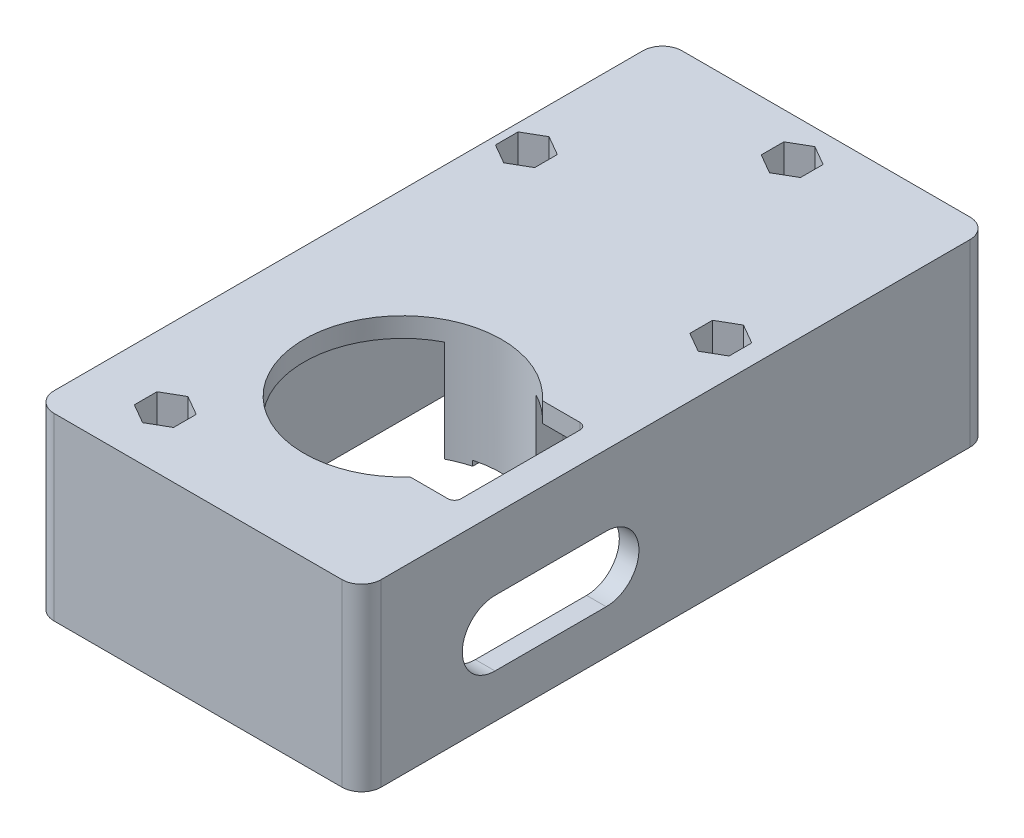
from build123d import *
from build123d.topology import SkipClean

# Parameters (mm, degrees)
SKETCH_1_W               = 50
SKETCH_1_H               = 38
EXTRUDE_1_DEPTH          = 3
SKETCH_2_W               = 50
SKETCH_2_H               = 38
SKETCH_2_W_2             = 44
SKETCH_2_H_2             = 32
EXTRUDE_2_DEPTH          = 90
SKETCH_4_R               = 7.3
CUT_EXTRUDE_1_DEPTH      = 45.2
SKETCH_5_R               = 10.3
SKETCH_5_R_2             = 7.3
EXTRUDE_3_DEPTH          = 16
SKETCH_6_R               = 8.3
SKETCH_6_R_2             = 5.8
EXTRUDE_5_DEPTH          = 1
SKETCH_7_R               = 4.3
EXTRUDE_6_DEPTH          = 2
SKETCH_8_R               = 6.3
SKETCH_8_R_2             = 4.3
EXTRUDE_7_DEPTH          = 10
SKETCH_9_W               = 2.635644668
SKETCH_9_H               = 4.5
CUT_EXTRUDE_2_DEPTH      = 4
SKETCH_10_R              = 0.7
SKETCH_10_W              = 2.7
SKETCH_10_H              = 2
EXTRUDE_8_DEPTH          = 32
SKETCH_11_W              = 14.06
SKETCH_11_H              = 9.36
EXTRUDE_9_DEPTH          = 4.4
SKETCH_12_W              = 14.06
SKETCH_12_H              = 9.36
EXTRUDE_10_DEPTH         = 21.2
CUT_EXTRUDE_3_DEPTH      = 3
SKETCH_14_R              = 1.65
EXTRUDE_11_DEPTH         = 15.5
EXTRUDE_12_DEPTH         = 15.5
CUT_EXTRUDE_4_DEPTH      = 0.8
EXTRUDE_13_DEPTH         = 18
SKETCH_18_W              = 19.83
SKETCH_18_H              = 32
SKETCH_18_R              = 6.3
EXTRUDE_14_DEPTH         = 10
SKETCH_19_W              = 4.445486426
SKETCH_19_H              = 4.5
CUT_EXTRUDE_5_DEPTH      = 4
EXTRUDE_16_REACH         = 110.743
SKETCH_23_R              = 1.65
CUT_EXTRUDE_7_DEPTH      = 109.742815855
CUT_EXTRUDE_7_DEPTH_BACK = 109.742815855
SKETCH_25_R              = 1.65
CUT_EXTRUDE_8_DEPTH      = 24.5
SKETCH_29_W              = 50
SKETCH_29_H              = 38
EXTRUDE_17_DEPTH         = 3
SKETCH_30_W              = 96
SKETCH_30_H              = 0.02
CUT_EXTRUDE_9_DEPTH      = 113.218536793
FILLET_1_R               = 3
CUT_EXTRUDE_10_DEPTH     = 3


with BuildPart() as part:
    # 草图1 → 凸台-拉伸1 (new body)
    with BuildSketch(Plane.XY):
        with Locations((25, 19)):
            Rectangle(SKETCH_1_W, SKETCH_1_H)
    extrude(amount=-EXTRUDE_1_DEPTH)

    # 草图2 → 凸台-拉伸2 (add)
    with BuildSketch(Plane.XY):
        with Locations((25, 19)):
            Rectangle(SKETCH_2_W, SKETCH_2_H)
        with Locations((25, 19)):
            Rectangle(SKETCH_2_W_2, SKETCH_2_H_2, mode=Mode.SUBTRACT)
    extrude(amount=EXTRUDE_2_DEPTH)

    # 草图4 → 切除-拉伸1 (cut)
    with BuildSketch(Plane(origin=(0, 0, -3), x_dir=(-1, 0, 0), z_dir=(0, 0, -1))):
        with Locations((-12.5, 10.5)):
            Circle(SKETCH_4_R)
    extrude(amount=-CUT_EXTRUDE_1_DEPTH, mode=Mode.SUBTRACT)

    # 草图5 → 凸台-拉伸3 (add)
    with BuildSketch(Plane.XY):
        with Locations((12.5, 10.5)):
            Circle(SKETCH_5_R)
        with Locations(Location((12.5, 10.5, 0), (0, 0, 180))):
            Circle(SKETCH_5_R_2, mode=Mode.SUBTRACT)
    extrude(amount=EXTRUDE_3_DEPTH)

    # 草图6 → 凸台-拉伸5 (add)
    with BuildSketch(Plane(origin=(0, 0, -3), x_dir=(-1, 0, 0), z_dir=(0, 0, -1))):
        with Locations((-12.5, 10.5)):
            Circle(SKETCH_6_R)
        with Locations((-12.5, 10.5)):
            Circle(SKETCH_6_R_2, mode=Mode.SUBTRACT)
    extrude(amount=-EXTRUDE_5_DEPTH)

    # 草图7 → 凸台-拉伸6 (add)
    with BuildSketch(Plane.XY.offset(16)):
        with BuildLine():
            Line((5.440254962, 3), (19.559745038, 3))
            ThreePointArc((19.559745038, 3), (18.368221419, 18.964867239), (3, 14.479949748))
            Line((3, 14.479949748), (3, 6.520050252))
            ThreePointArc((3, 6.520050252), (4.035132761, 4.631778581), (5.440254962, 3))
        make_face()
        with Locations((12.5, 10.5)):
            Circle(SKETCH_7_R, mode=Mode.SUBTRACT)
    extrude(amount=EXTRUDE_6_DEPTH)

    # 草图8 → 凸台-拉伸7 (add)
    with BuildSketch(Plane.XY.offset(18)):
        with Locations((12.5, 10.5)):
            Circle(SKETCH_8_R)
        with Locations((12.5, 10.5)):
            Circle(SKETCH_8_R_2, mode=Mode.SUBTRACT)
    extrude(amount=EXTRUDE_7_DEPTH)

    # 草图9 → 切除-拉伸2 (cut)
    with BuildSketch(Plane.XY.offset(28)):
        with Locations((17.482177666, 10.5)):
            Rectangle(SKETCH_9_W, SKETCH_9_H)
    extrude(amount=-CUT_EXTRUDE_2_DEPTH, mode=Mode.SUBTRACT)

    # 草图10 → 凸台-拉伸8 (add)
    with BuildSketch(Plane(origin=(0, 3, 0), x_dir=(1, 0, 0), z_dir=(0, 1, 0))):
        with Locations(Location((19.92, -32.88, 0), (0, 0, 180))):
            Circle(SKETCH_10_R)
        with Locations(Location((26.54, -32.88, 0), (0, 0, 180))):
            Circle(SKETCH_10_R)
        with Locations((20.68, -35.76)):
            Rectangle(SKETCH_10_W, SKETCH_10_H)
        with Locations((25.78, -35.76)):
            Rectangle(SKETCH_10_W, SKETCH_10_H)
    extrude(amount=EXTRUDE_8_DEPTH)

    # 草图11 → 凸台-拉伸9 (add)
    with BuildSketch(Plane(origin=(0, 3, 0), x_dir=(1, 0, 0), z_dir=(0, 1, 0))):
        with Locations((23.23, -32.08)):
            Rectangle(SKETCH_11_W, SKETCH_11_H)
    extrude(amount=EXTRUDE_9_DEPTH)

    # 草图12 → 凸台-拉伸10 (add)
    with BuildSketch(Plane.XZ.offset(-35)):
        with Locations((23.23, 32.08)):
            Rectangle(SKETCH_12_W, SKETCH_12_H)
    extrude(amount=EXTRUDE_10_DEPTH)

    # 草图13 → 切除-拉伸3 (cut)
    with BuildSketch(Plane(origin=(0, 38, 0), x_dir=(1, 0, 0), z_dir=(0, 1, 0))):
        with BuildLine():
            Line((38.62497216, -74.195968058), (44.4, -74.195968058))
            ThreePointArc((44.4, -74.195968058), (45.107106781, -73.903074839), (45.4, -73.195968058))
            Line((45.4, -73.195968058), (45.4, -54.995968058))
            ThreePointArc((45.4, -54.995968058), (45.107106781, -54.288861277), (44.4, -53.995968058))
            Line((44.4, -53.995968058), (38.62497216, -53.995968058))
            ThreePointArc((38.62497216, -53.995968058), (12.3, -64.095968058), (38.62497216, -74.195968058))
        make_face()
    extrude(amount=-CUT_EXTRUDE_3_DEPTH, mode=Mode.SUBTRACT)

    # 草图14 → 凸台-拉伸11 (add)
    # profile 1 of 2: a face of its own
    with SkipClean():  # the faces are left unmerged after this step: merging them gives an invalid solid
        with BuildSketch(Plane.XZ.offset(-35)):
            with BuildLine():
                Line((23.9, 46.595968058), (23.9, 49.407196837))
                ThreePointArc((23.9, 49.407196837), (27.4, 48.995968058), (30.9, 49.407196837))
                Line((30.9, 49.407196837), (30.9, 46.595968058))
                ThreePointArc((30.9, 46.595968058), (27.4, 43.095968058), (23.9, 46.595968058))
            make_face()
            with Locations((27.4, 46.595968058)):
                Circle(SKETCH_14_R, mode=Mode.SUBTRACT)
        # profile 2 of 2: a face of its own
        with BuildSketch(Plane.XZ.offset(-35)):
            with BuildLine():
                Line((30.9, 81.595968058), (30.9, 78.78473928))
                ThreePointArc((30.9, 78.78473928), (27.4, 79.195968058), (23.9, 78.78473928))
                Line((23.9, 78.78473928), (23.9, 81.595968058))
                ThreePointArc((23.9, 81.595968058), (27.4, 85.095968058), (30.9, 81.595968058))
            make_face()
            with Locations(Location((27.4, 81.595968058, 0), (0, 0, 90))):
                Circle(SKETCH_14_R, mode=Mode.SUBTRACT)
        extrude(amount=EXTRUDE_11_DEPTH)

    # 草图15 → 凸台-拉伸12 (add)
    with SkipClean():  # the faces are left unmerged after this step: merging them gives an invalid solid
        with BuildSketch(Plane.XZ.offset(-35)):
            with BuildLine():
                ThreePointArc((23.9, 49.407196837), (22.109340992, 49.953163271), (20.4, 50.716506186))
                Line((20.4, 50.716506186), (20.4, 46.595968058))
                ThreePointArc((20.4, 46.595968058), (27.4, 39.595968058), (34.4, 46.595968058))
                Line((34.4, 46.595968058), (34.4, 50.716506186))
                ThreePointArc((34.4, 50.716506186), (32.690659008, 49.953163271), (30.9, 49.407196837))
                Line((30.9, 49.407196837), (30.9, 46.595968058))
                ThreePointArc((30.9, 46.595968058), (27.4, 43.095968058), (23.9, 46.595968058))
                Line((23.9, 46.595968058), (23.9, 49.407196837))
            make_face()
            with BuildLine():
                Line((20.4, 81.595968058), (20.4, 77.475429931))
                ThreePointArc((20.4, 77.475429931), (22.109340992, 78.238772846), (23.9, 78.78473928))
                Line((23.9, 78.78473928), (23.9, 81.595968058))
                ThreePointArc((23.9, 81.595968058), (27.4, 85.095968058), (30.9, 81.595968058))
                Line((30.9, 81.595968058), (30.9, 78.78473928))
                ThreePointArc((30.9, 78.78473928), (32.690659008, 78.238772846), (34.4, 77.475429931))
                Line((34.4, 77.475429931), (34.4, 81.595968058))
                ThreePointArc((34.4, 81.595968058), (27.4, 88.595968058), (20.4, 81.595968058))
            make_face()
        extrude(amount=EXTRUDE_12_DEPTH)

    # 草图16 → 切除-拉伸4 (cut)
    with SkipClean():  # the faces are left unmerged after this step: merging them gives an invalid solid
        with BuildSketch(Plane.XZ.offset(-19.5)):
            with BuildLine():
                Line((31.3, 81.595968058), (31.3, 77.229132186))
                ThreePointArc((31.3, 77.229132186), (27.4, 77.795968058), (23.5, 77.229132186))
                Line((23.5, 77.229132186), (23.5, 81.595968058))
                ThreePointArc((23.5, 81.595968058), (27.4, 85.495968058), (31.3, 81.595968058))
            make_face()
            with BuildLine():
                Line((31.3, 46.595968058), (31.3, 50.962803931))
                ThreePointArc((31.3, 50.962803931), (27.4, 50.395968058), (23.5, 50.962803931))
                Line((23.5, 50.962803931), (23.5, 46.595968058))
                ThreePointArc((23.5, 46.595968058), (27.4, 42.695968058), (31.3, 46.595968058))
            make_face()
        extrude(amount=-CUT_EXTRUDE_4_DEPTH, mode=Mode.SUBTRACT)

    # 草图17 → 凸台-拉伸13 (add)
    with SkipClean():  # the faces are left unmerged after this step: merging them gives an invalid solid
        with BuildSketch(Plane.XY):
            with BuildLine():
                Line((22.83, 3), (22.83, 10.539153682))
                Line((22.83, 10.539153682), (22.83, 35))
                Line((22.83, 35), (3, 35))
                Line((3, 35), (3, 14.479949748))
                ThreePointArc((3, 14.479949748), (18.368221419, 18.964867239), (19.559745038, 3))
                Line((19.559745038, 3), (22.83, 3))
            make_face()
            with BuildLine():
                Line((5.440254962, 3), (3, 3))
                Line((3, 3), (3, 6.520050252))
                ThreePointArc((3, 6.520050252), (4.035132761, 4.631778581), (5.440254962, 3))
            make_face()
        extrude(amount=EXTRUDE_13_DEPTH)

    # 草图18 → 凸台-拉伸14 (add)
    with SkipClean():  # the faces are left unmerged after this step: merging them gives an invalid solid
        with BuildSketch(Plane.XY.offset(18)):
            with Locations((12.915, 19)):
                Rectangle(SKETCH_18_W, SKETCH_18_H)
            with Locations((12.5, 10.5)):
                Circle(SKETCH_18_R, mode=Mode.SUBTRACT)
        extrude(amount=EXTRUDE_14_DEPTH)

    # 草图19 → 切除-拉伸5 (cut)
    with SkipClean():  # the faces are left unmerged after this step: merging them gives an invalid solid
        with BuildSketch(Plane.XY.offset(28)):
            with Locations((20.607256787, 10.5)):
                Rectangle(SKETCH_19_W, SKETCH_19_H)
        extrude(amount=-CUT_EXTRUDE_5_DEPTH, mode=Mode.SUBTRACT)

    # 草图23 → 凸台-拉伸16 (add, up to next)
    with BuildSketch(Plane.XZ.offset(-35), mode=Mode.PRIVATE) as extrude_16_sk1:
        with BuildLine():
            Line((22.83, 0), (22.83, 9))
            ThreePointArc((22.83, 9), (29.193961031, 6.363961031), (31.83, 0))
            Line((31.83, 0), (22.83, 0))
        make_face()
        with Locations(Location((25.83, 3, 0), (0, 0, 180))):
            Circle(SKETCH_23_R, mode=Mode.SUBTRACT)
    extrude_16_tool1 = extrude(extrude_16_sk1.sketch, amount=EXTRUDE_16_REACH, mode=Mode.PRIVATE) - part.part
    # 草图23 → 凸台-拉伸16 (add, up to next)
    with BuildSketch(Plane.XZ.offset(-35), mode=Mode.PRIVATE) as extrude_16_sk2:
        with BuildLine():
            Line((44, 26.08), (47, 26.08))
            Line((47, 26.08), (47, 38.08))
            Line((47, 38.08), (44, 38.08))
            ThreePointArc((44, 38.08), (38, 32.08), (44, 26.08))
        make_face()
        with Locations(Location((44, 32.08, 0), (0, 0, 180))):
            Circle(SKETCH_23_R, mode=Mode.SUBTRACT)
    extrude_16_tool2 = extrude(extrude_16_sk2.sketch, amount=EXTRUDE_16_REACH, mode=Mode.PRIVATE) - part.part
    # 草图23 → 凸台-拉伸16 (add, up to next)
    with BuildSketch(Plane.XZ.offset(-35), mode=Mode.PRIVATE) as extrude_16_sk3:
        with BuildLine():
            Line((5, 90), (5, 84))
            ThreePointArc((5, 84), (11, 78), (17, 84))
            Line((17, 84), (17, 90))
            Line((17, 90), (5, 90))
        make_face()
        with Locations(Location((11, 84, 0), (0, 0, 180))):
            Circle(SKETCH_23_R, mode=Mode.SUBTRACT)
    extrude_16_tool3 = extrude(extrude_16_sk3.sketch, amount=EXTRUDE_16_REACH, mode=Mode.PRIVATE) - part.part
    add(extrude_16_tool1.solids().sort_by_distance((27.33, 35, 0.127279))[0])
    add(extrude_16_tool2.solids().sort_by_distance((45.5, 35, 26.23))[0])
    add(extrude_16_tool3.solids().sort_by_distance((11, 35, 78.169706))[0])

    # 草图25 → 切除-拉伸7 (cut, two sides: drawn at the far end of the back side and taken through both)
    with BuildSketch(Plane.XZ.offset(-35).offset(-CUT_EXTRUDE_7_DEPTH_BACK)):
        with Locations((4.2, 22)):
            Circle(SKETCH_25_R)
        with Locations((25.83, 3)):
            Circle(SKETCH_25_R)
        with Locations((44, 32.08)):
            Circle(SKETCH_25_R)
        with Locations((11, 84)):
            Circle(SKETCH_25_R)
    extrude(amount=CUT_EXTRUDE_7_DEPTH + CUT_EXTRUDE_7_DEPTH_BACK, mode=Mode.SUBTRACT)

    # 草图26 → 切除-拉伸8 (cut)
    with SkipClean():  # the faces are left unmerged after this step: merging them gives an invalid solid
        with BuildSketch(Plane(origin=(0, 38, 0), x_dir=(1, 0, 0), z_dir=(0, 1, 0))):
            Polygon((4.2, -18.537081721), (1.201024799, -20.268540861), (1.201024799, -23.731459139), (4.2, -25.462918279), (7.198975201, -23.731459139), (7.198975201, -20.268540861), align=None)
            Polygon((25.83, -6.462918279), (28.828975201, -4.731459139), (28.828975201, -1.268540861), (25.83, 0.462918279), (22.831024799, -1.268540861), (22.831024799, -4.731459139), align=None)
            Polygon((11, -80.537081721), (8.001024799, -82.268540861), (8.001024799, -85.731459139), (11, -87.462918279), (13.998975201, -85.731459139), (13.998975201, -82.268540861), align=None)
            Polygon((44, -28.617081721), (41.001024799, -30.348540861), (41.001024799, -33.811459139), (44, -35.542918279), (46.998975201, -33.811459139), (46.998975201, -30.348540861), align=None)
        extrude(amount=-CUT_EXTRUDE_8_DEPTH, mode=Mode.SUBTRACT)

    # 草图29 → 凸台-拉伸17 (add)
    with SkipClean():  # the faces are left unmerged after this step: merging them gives an invalid solid
        with BuildSketch(Plane.XY.offset(90)):
            with Locations((25, 19)):
                Rectangle(SKETCH_29_W, SKETCH_29_H)
        extrude(amount=EXTRUDE_17_DEPTH)

    # 草图30 → 切除-拉伸9 (cut, through all)
    with SkipClean():  # the faces are left unmerged after this step: merging them gives an invalid solid
        with BuildSketch(Plane(origin=(50, 0, 0), x_dir=(0, 0, -1), z_dir=(1, 0, 0))):
            with Locations((-45, 10.5)):
                Rectangle(SKETCH_30_W, SKETCH_30_H)
        extrude(amount=-CUT_EXTRUDE_9_DEPTH, mode=Mode.SUBTRACT)


with BuildPart() as cut_extrude_9_piece_1:
    # of the separate pieces the step leaves, piece 1, a body of its own (cut_extrude_9_pieces)
    add(part.part.solids().sort_by_distance((50, 38, -3))[0])

    # 圆角1
    fillet_1_edges = [cut_extrude_9_piece_1.edges().sort_by_distance(p)[0] for p in [
        (0, 24.255, 93),
        (50, 24.255, -3),
        (0, 24.255, -3),
        (50, 24.255, 93),
    ]]
    fillet(fillet_1_edges, radius=FILLET_1_R - 0.0001)  # a hair under: the kernel refuses the full size

    # 草图33 → 切除-拉伸10 (cut)
    with BuildSketch(Plane(origin=(50, 0, 0), x_dir=(0, 0, -1), z_dir=(1, 0, 0))):
        with BuildLine():
            Line((-55.595968058, 17.2), (-72.595968058, 17.2))
            ThreePointArc((-72.595968058, 17.2), (-77.595968058, 22.2), (-72.595968058, 27.2))
            Line((-72.595968058, 27.2), (-55.595968058, 27.2))
            ThreePointArc((-55.595968058, 27.2), (-50.595968058, 22.2), (-55.595968058, 17.2))
        make_face()
    extrude(amount=-CUT_EXTRUDE_10_DEPTH, mode=Mode.SUBTRACT)


with BuildPart() as cut_extrude_9_piece_2:
    # of the separate pieces the step leaves, piece 2, a body of its own (cut_extrude_9_pieces)
    add(part.part.solids().sort_by_distance((50, 0, -3))[0])


solid = cut_extrude_9_piece_1.part
